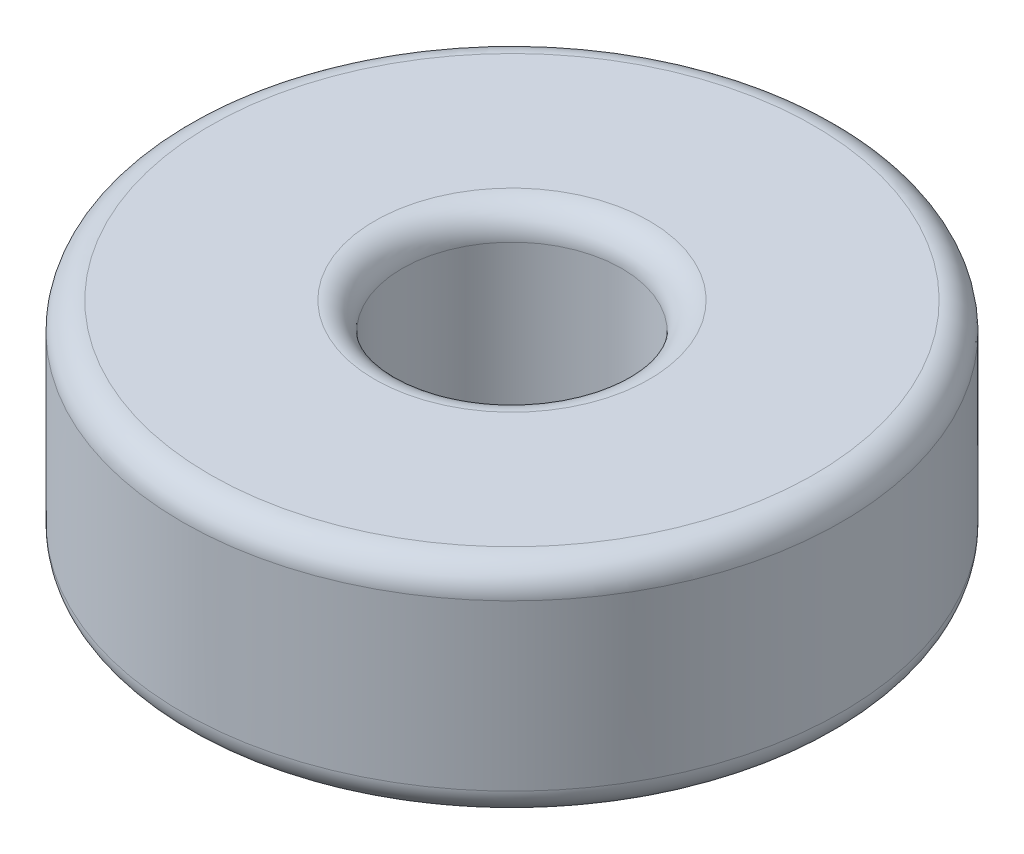
from build123d import *

# Parameters (mm, degrees)
ESQUISSE1_W = 4
ESQUISSE1_H = 4
CONG_1_R    = 0.5


with BuildPart() as part:
    # Esquisse1 → Révolution1 (revolve)
    with BuildSketch(Plane.XY):
        with Locations((4, 2)):
            Rectangle(ESQUISSE1_W, ESQUISSE1_H)
    revolve(axis=Axis((0, 0, 0), (0, 1, 0)))

    # Congé1
    cong_1_edges = [part.edges().sort_by_distance(p)[0] for p in [
        (-2, 0, 0),
        (-6, 0, 0),
        (-6, 4, 0),
        (-2, 4, 0),
    ]]
    fillet(cong_1_edges, radius=CONG_1_R)


solid = part.part
